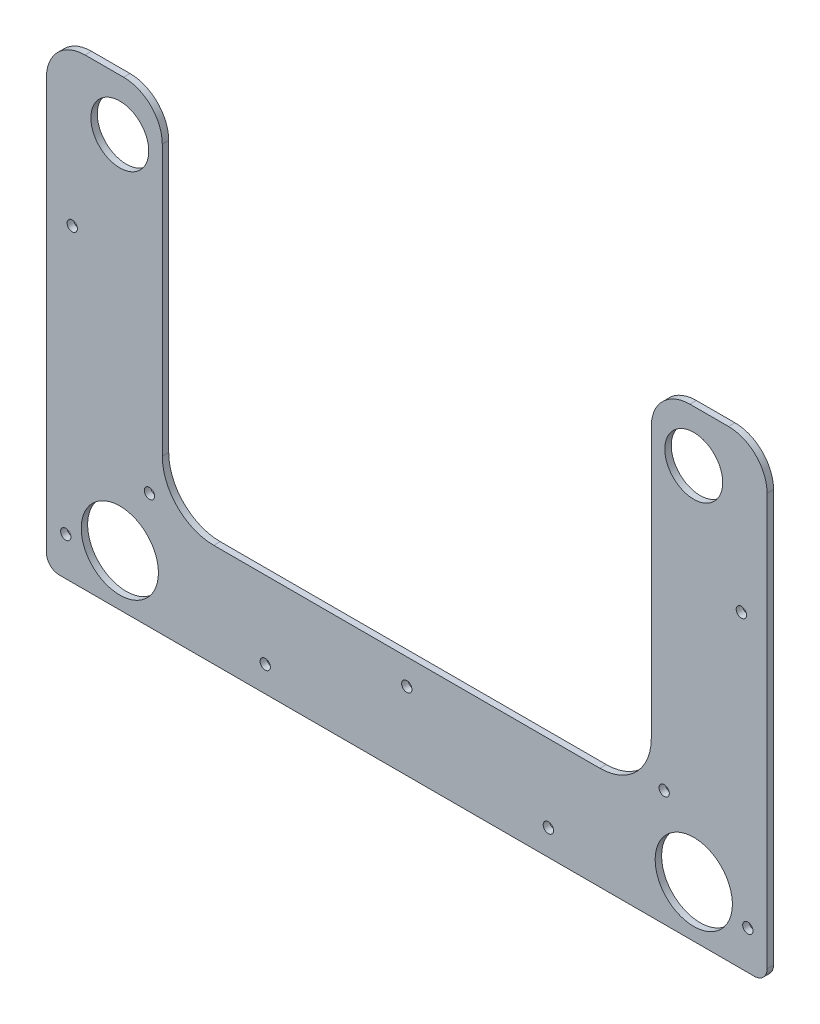
from build123d import *

# Parameters (mm, degrees)
SKETCH1_R           = 14.2875
SKETCH1_R_2         = 19.05
SKETCH1_R_3         = 2.54
BOSS_EXTRUDE3_DEPTH = 3.175
SKETCH2_W           = 355.6
SKETCH2_H           = 19.05
CUT_EXTRUDE1_DEPTH  = 290.621961572
FILLET1_R           = 19.05


with BuildPart() as part:
    # Sketch1 → Boss-Extrude3 (new body)
    with BuildSketch(Plane.XY):
        with BuildLine():
            Line((120.65, -152.4), (120.65, -6.35))
            Line((120.65, -6.35), (120.65, 6.35))
            ThreePointArc((120.65, 6.35), (124.369743879, 15.330256121), (133.35, 19.05))
            Line((133.35, 19.05), (165.1, 19.05))
            ThreePointArc((165.1, 19.05), (174.080256121, 15.330256121), (177.8, 6.35))
            Line((177.8, 6.35), (177.8, -6.35))
            Line((177.8, -6.35), (177.8, -222.25))
            ThreePointArc((177.8, -222.25), (175.940128061, -226.740128061), (171.45, -228.6))
            Line((171.45, -228.6), (12.7, -228.6))
            Line((12.7, -228.6), (-12.7, -228.6))
            Line((-12.7, -228.6), (-171.45, -228.6))
            ThreePointArc((-171.45, -228.6), (-175.940128061, -226.740128061), (-177.8, -222.25))
            Line((-177.8, -222.25), (-177.8, -6.35))
            Line((-177.8, -6.35), (-177.8, 6.35))
            ThreePointArc((-177.8, 6.35), (-174.080256121, 15.330256121), (-165.1, 19.05))
            Line((-165.1, 19.05), (-133.35, 19.05))
            ThreePointArc((-133.35, 19.05), (-124.369743879, 15.330256121), (-120.65, 6.35))
            Line((-120.65, 6.35), (-120.65, -6.35))
            Line((-120.65, -6.35), (-120.65, -152.4))
            ThreePointArc((-120.65, -152.4), (-113.210512242, -170.360512242), (-95.25, -177.8))
            Line((-95.25, -177.8), (-12.7, -177.8))
            Line((-12.7, -177.8), (12.7, -177.8))
            Line((12.7, -177.8), (95.25, -177.8))
            ThreePointArc((95.25, -177.8), (113.210512242, -170.360512242), (120.65, -152.4))
        make_face()
        with Locations((141.605, -25.4)):
            Circle(SKETCH1_R, mode=Mode.SUBTRACT)
        with Locations((-141.605, -25.4)):
            Circle(SKETCH1_R, mode=Mode.SUBTRACT)
        with Locations((-141.605, -203.2)):
            Circle(SKETCH1_R_2, mode=Mode.SUBTRACT)
        with Locations((141.605, -203.2)):
            Circle(SKETCH1_R_2, mode=Mode.SUBTRACT)
        with Locations((-69.85, -215.9)):
            Circle(SKETCH1_R_3, mode=Mode.SUBTRACT)
        with Locations((69.85, -215.9)):
            Circle(SKETCH1_R_3, mode=Mode.SUBTRACT)
        with Locations((0, -190.5)):
            Circle(SKETCH1_R_3, mode=Mode.SUBTRACT)
        with Locations((-149.225, 6.35)):
            Circle(SKETCH1_R_3, mode=Mode.SUBTRACT)
        with Locations((149.225, 6.35)):
            Circle(SKETCH1_R_3, mode=Mode.SUBTRACT)
        with Locations((-168.275, -209.55)):
            Circle(SKETCH1_R_3, mode=Mode.SUBTRACT)
        with Locations((168.275, -209.55)):
            Circle(SKETCH1_R_3, mode=Mode.SUBTRACT)
        with Locations((-165.1, -76.2)):
            Circle(SKETCH1_R_3, mode=Mode.SUBTRACT)
        with Locations((165.1, -76.2)):
            Circle(SKETCH1_R_3, mode=Mode.SUBTRACT)
        with Locations((-127, -171.45)):
            Circle(SKETCH1_R_3, mode=Mode.SUBTRACT)
        with Locations((127, -171.45)):
            Circle(SKETCH1_R_3, mode=Mode.SUBTRACT)
    extrude(amount=BOSS_EXTRUDE3_DEPTH)

    # Sketch2 → Cut-Extrude1 (cut, through all)
    with BuildSketch(Plane.XY.offset(3.175)):
        with Locations((0, 9.525)):
            Rectangle(SKETCH2_W, SKETCH2_H)
    extrude(amount=-CUT_EXTRUDE1_DEPTH, mode=Mode.SUBTRACT)

    # Fillet1
    fillet1_edges = [part.edges().sort_by_distance(p)[0] for p in [
        (177.8, 0, 1.5875),
        (120.65, 0, 1.5875),
        (-120.65, 0, 1.5875),
        (-177.8, 0, 1.5875),
    ]]
    fillet(fillet1_edges, radius=FILLET1_R)


solid = part.part
